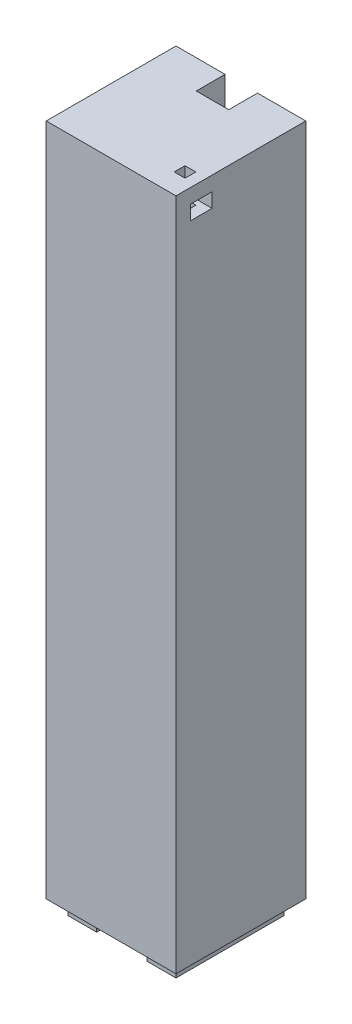
from build123d import *

# Parameters (mm, degrees)
SKETCH1_W           = 36
SKETCH1_H           = 36
BOSS_EXTRUDE1_DEPTH = 186.9
BOSS_EXTRUDE2_DEPTH = 4
SKETCH3_R           = 2
CUT_EXTRUDE1_DEPTH  = 5
SKETCH4_W           = 9
SKETCH4_H           = 186.9
CUT_EXTRUDE2_DEPTH  = 8
SKETCH5_W           = 6
SKETCH5_H           = 4
CUT_EXTRUDE3_DEPTH  = 9
SKETCH6_W           = 3
SKETCH6_H           = 3
CUT_EXTRUDE4_DEPTH  = 10


with BuildPart() as part:
    # Sketch1 → Boss-Extrude1 (new body)
    with BuildSketch(Plane(origin=(0, 0, 0), x_dir=(1, 0, 0), z_dir=(0, 1, 0))):
        with Locations((18, 18)):
            Rectangle(SKETCH1_W, SKETCH1_H)
    extrude(amount=BOSS_EXTRUDE1_DEPTH)

    # Sketch2 → Boss-Extrude2 (add)
    with BuildSketch(Plane.XZ):
        Polygon((3, -3), (7, -3), (11, -3), (11, -11), (7, -11), (7, -25), (11, -25), (11, -33), (7, -33), (3, -33), align=None)
        Polygon((29, -3), (33, -3), (33, -33), (29, -33), (25, -33), (25, -25), (29, -25), (29, -11), (25, -11), (25, -3), align=None)
    extrude(amount=BOSS_EXTRUDE2_DEPTH)

    # Sketch3 → Cut-Extrude1 (cut)
    with BuildSketch(Plane.XZ):
        with Locations((18, -18)):
            Circle(SKETCH3_R)
    extrude(amount=-CUT_EXTRUDE1_DEPTH, mode=Mode.SUBTRACT)

    # Sketch4 → Cut-Extrude2 (cut)
    with BuildSketch(Plane.XY.offset(-36)):
        with Locations((18.12, 93.45)):
            Rectangle(SKETCH4_W, SKETCH4_H)
    extrude(amount=CUT_EXTRUDE2_DEPTH, mode=Mode.SUBTRACT)

    # Sketch5 → Cut-Extrude3 (cut)
    with BuildSketch(Plane(origin=(36, 0, 0), x_dir=(0, 0, -1), z_dir=(1, 0, 0))):
        with Locations((7, 180.9)):
            Rectangle(SKETCH5_W, SKETCH5_H)
    extrude(amount=-CUT_EXTRUDE3_DEPTH, mode=Mode.SUBTRACT)

    # Sketch6 → Cut-Extrude4 (cut)
    with BuildSketch(Plane(origin=(0, 186.9, 0), x_dir=(1, 0, 0), z_dir=(0, 1, 0))):
        with Locations((31.5, 7)):
            Rectangle(SKETCH6_W, SKETCH6_H)
    extrude(amount=-CUT_EXTRUDE4_DEPTH, mode=Mode.SUBTRACT)


solid = part.part
